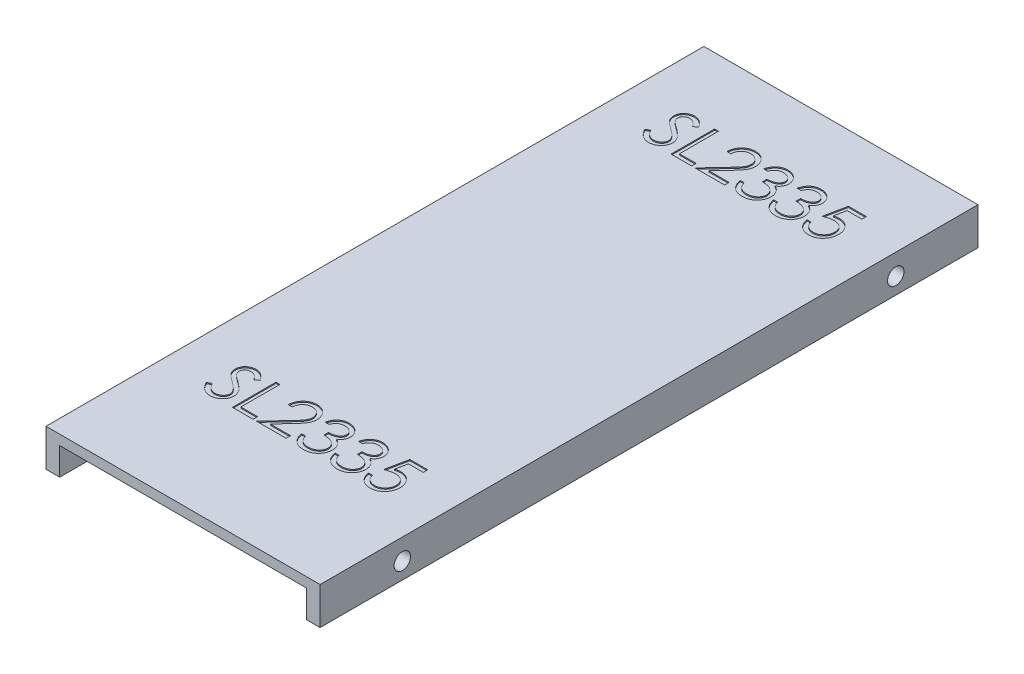
from build123d import *

# Parameters (mm, degrees)
BOSS_EXTRUDE1_DEPTH = 1200
SKETCH2_R           = 15
CUT_EXTRUDE1_DEPTH  = 1200
SKETCH4_R           = 15
CUT_EXTRUDE2_DEPTH  = 1200
CUT_EXTRUDE3_DEPTH  = 2
CUT_EXTRUDE6_DEPTH  = 2


with BuildPart() as part:
    # Sketch1 → Boss-Extrude1 (new body)
    with BuildSketch(Plane.XY):
        Polygon((0, 0), (25, 0), (25, 50), (475, 50), (475, 0), (500, 0), (500, 68), (0, 68), align=None)
    extrude(amount=BOSS_EXTRUDE1_DEPTH)

    # Sketch2 → Cut-Extrude1 (cut)
    with BuildSketch(Plane(origin=(500, 0, 0), x_dir=(0, 0, -1), z_dir=(1, 0, 0))):
        with Locations((-1050, 30)):
            Circle(SKETCH2_R)
    extrude(amount=-CUT_EXTRUDE1_DEPTH, mode=Mode.SUBTRACT)

    # Sketch4 → Cut-Extrude2 (cut)
    with BuildSketch(Plane(origin=(500, 0, 0), x_dir=(0, 0, -1), z_dir=(1, 0, 0))):
        with Locations((-150, 30)):
            Circle(SKETCH4_R)
    extrude(amount=-CUT_EXTRUDE2_DEPTH, mode=Mode.SUBTRACT)

    # Sketch9 → Cut-Extrude3 (cut)
    with BuildSketch(Plane(origin=(0, 68, 0), x_dir=(1, 0, 0), z_dir=(0, 1, 0))):
        with BuildLine():
            Line((77.03525641, -184.687875601), (83.745242388, -180.665064103))
            add(Edge.make_bspline(
                [(83.745242388, -180.665064103), (84.369316697, -181.709738547), (85.56501899, -183.711294468), (87.55963017, -186.415896456), (89.626394406, -188.714645368), (91.780616792, -190.594168432), (94.009148115, -192.073919971), (96.326536477, -193.121720583), (98.724972541, -193.775225739), (100.357235992, -193.854602702), (101.172125401, -193.894230769)],
                knots=[0, 0, 0, 0, 1.272034388, 2.437168799, 3.508375237, 4.49857839, 5.41946034, 6.295179144, 7.148887113, 8, 8, 8, 8], degree=3))
            add(Edge.make_bspline(
                [(101.172125401, -193.894230769), (101.868059559, -193.874848018), (103.247750662, -193.836421667), (105.278894386, -193.467196335), (107.251517402, -192.899956983), (109.124963293, -192.087589429), (110.873381694, -191.104734485), (112.406604963, -189.917597959), (113.732079316, -188.588492937), (114.816321735, -187.105707733), (115.648172536, -185.511015256), (116.287528373, -183.874167788), (116.642336293, -182.169452043), (116.695784095, -181.021679046), (116.72275641, -180.442457933)],
                knots=[0, 0, 0, 0, 1.095163259, 2.171163733, 3.241058638, 4.321873601, 5.38011039, 6.391990106, 7.366004449, 8.327778327, 9.272591725, 10.192022065, 11.087607919, 12, 12, 12, 12], degree=3))
            add(Edge.make_bspline(
                [(116.72275641, -180.442457933), (116.68932115, -179.781585091), (116.621352151, -178.438127176), (116.046870371, -176.456027904), (115.14314638, -174.494499977), (114.309422139, -173.281167704), (113.876577524, -172.651241987)],
                knots=[0, 0, 0, 0, 0.938893495, 1.908633276, 2.914225137, 4, 4, 4, 4], degree=3))
            add(Edge.make_bspline(
                [(113.876577524, -172.651241987), (113.521190381, -172.196608666), (112.775099528, -171.242162877), (111.492455939, -169.82145843), (109.987367275, -168.356005), (108.311340227, -166.789844244), (106.403321962, -165.195817426), (104.323072974, -163.497911837), (102.017481887, -161.760697501), (100.40051116, -160.595641104), (99.566180889, -159.994491186)],
                knots=[0, 0, 0, 0, 0.722233717, 1.516239348, 2.393582979, 3.351407094, 4.387010283, 5.505090956, 6.712668013, 8, 8, 8, 8], degree=3))
            add(Edge.make_bspline(
                [(99.566180889, -159.994491186), (98.731065262, -159.399664288), (97.134387775, -158.262400555), (94.901487783, -156.574564114), (92.904765139, -155.031426358), (91.153094586, -153.61846037), (89.647246586, -152.335474512), (88.375354943, -151.194789107), (87.369819809, -150.16555478), (86.810666462, -149.497867208), (86.559620393, -149.198091947)],
                knots=[0, 0, 0, 0, 1.452282411, 2.77665338, 3.964542531, 5.026858415, 5.96415736, 6.766646006, 7.446254459, 8, 8, 8, 8], degree=3))
            add(Edge.make_bspline(
                [(86.559620393, -149.198091947), (86.20872517, -148.730889861), (85.518642623, -147.812074258), (84.607735, -146.375956948), (83.833507558, -144.905857893), (83.226576097, -143.397826679), (82.715486848, -141.873034542), (82.371726633, -140.311586648), (82.15647531, -138.720489408), (82.134432044, -137.649754662), (82.123397436, -137.113757011)],
                knots=[0, 0, 0, 0, 1.068054152, 2.10047183, 3.106115577, 4.101338837, 5.06977816, 6.043150881, 7.020423561, 8, 8, 8, 8], degree=3))
            add(Edge.make_bspline(
                [(82.123397436, -137.113757011), (82.152997711, -136.273974624), (82.211565577, -134.612359607), (82.706877308, -132.185053274), (83.488673289, -129.867611312), (84.583932353, -127.682976958), (85.995840178, -125.688034177), (87.629739954, -123.859835454), (89.575821874, -122.322940822), (91.711068866, -120.980095926), (94.048240161, -119.929036551), (96.497319578, -119.136171465), (99.062199604, -118.6869258), (100.799449264, -118.622455952), (101.680939503, -118.58974359)],
                knots=[0, 0, 0, 0, 1.005424448, 1.989358655, 2.955360095, 3.929531133, 4.905563448, 5.876582895, 6.856512386, 7.866279853, 8.892233794, 9.918561126, 10.94386622, 12, 12, 12, 12], degree=3))
            add(Edge.make_bspline(
                [(101.680939503, -118.58974359), (102.616296778, -118.622005028), (104.476423862, -118.686162731), (107.212575715, -119.243999602), (109.846934819, -120.167032695), (111.966094575, -121.214525474), (113.62464113, -122.26072008), (114.889487032, -123.213669666), (116.171222076, -124.310748022), (117.480185105, -125.554877353), (118.794196489, -126.957473315), (120.132764067, -128.50893001), (121.49901802, -130.199766188), (122.377945562, -131.40682183), (122.828525641, -132.025615986)],
                knots=[0, 0, 0, 0, 1.286793592, 2.559021753, 3.825965368, 5.121522368, 5.803751409, 6.523245864, 7.299691795, 8.125521123, 9.008227632, 9.944561021, 10.946284179, 12, 12, 12, 12], degree=3))
            Line((122.828525641, -132.025615986), (116.388847155, -136.907051282))
            add(Edge.make_bspline(
                [(116.388847155, -136.907051282), (116.000001901, -136.406111339), (115.251176857, -135.441418131), (114.114311708, -134.090425795), (113.042779872, -132.856337777), (111.987083305, -131.784432195), (111.002977734, -130.816008814), (110.047823383, -129.986885758), (109.135365775, -129.288939219), (107.985178694, -128.544094198), (106.540151868, -127.805759207), (104.72621685, -127.180985472), (102.830599541, -126.805540317), (101.539516827, -126.755899474), (100.885917468, -126.730769231)],
                knots=[0, 0, 0, 0, 1.181633172, 2.275549214, 3.290209073, 4.226197932, 5.078386478, 5.862611352, 6.581680152, 7.217281963, 8.414376989, 9.595101626, 10.782541182, 12, 12, 12, 12], degree=3))
            add(Edge.make_bspline(
                [(100.885917468, -126.730769231), (100.065939192, -126.758248855), (98.484688331, -126.811240721), (96.239731191, -127.38999753), (94.219208247, -128.301264719), (92.483105433, -129.578407972), (91.037641846, -131.091544771), (89.992035906, -132.83277952), (89.362701817, -134.755523293), (89.285905832, -136.096771571), (89.246794872, -136.779847756)],
                knots=[0, 0, 0, 0, 1.14458467, 2.207223713, 3.21896685, 4.227309161, 5.202851033, 6.127160689, 7.046193047, 8, 8, 8, 8], degree=3))
            add(Edge.make_bspline(
                [(89.246794872, -136.779847756), (89.255710422, -137.205104502), (89.273556102, -138.056313371), (89.522448835, -139.313872405), (89.842201474, -140.568254567), (90.348900444, -141.813820285), (91.048427865, -143.07235307), (91.96702739, -144.365524618), (93.123936432, -145.704733011), (94.010147247, -146.575757381), (94.478039864, -147.035632011)],
                knots=[0, 0, 0, 0, 0.858281714, 1.717966888, 2.583508476, 3.4729293, 4.427298488, 5.488583878, 6.674047936, 8, 8, 8, 8], degree=3))
            add(Edge.make_bspline(
                [(94.478039864, -147.035632011), (94.651788845, -147.19068599), (95.064576653, -147.55905875), (95.819227112, -148.162133686), (96.815787001, -148.9060537), (98.028233349, -149.826516056), (99.478921731, -150.894256358), (101.168011665, -152.095622205), (103.076674999, -153.469613865), (104.431082734, -154.430222375), (105.147235577, -154.938151042)],
                knots=[0, 0, 0, 0, 0.420754252, 0.999615792, 1.744751191, 2.668019286, 3.750313428, 4.999500688, 6.413464383, 8, 8, 8, 8], degree=3))
            add(Edge.make_bspline(
                [(105.147235577, -154.938151042), (106.008701825, -155.565017589), (107.676811818, -156.778857775), (110.05029622, -158.602570518), (112.202352225, -160.386189556), (114.140535591, -162.118324574), (115.883994051, -163.785836683), (117.413385216, -165.40878738), (118.744292609, -166.975549474), (120.177107028, -168.984248959), (121.641186149, -171.451248549), (122.898520336, -174.473808601), (123.691325715, -177.508118013), (123.795001155, -179.547530197), (123.846153846, -180.553761018)],
                knots=[0, 0, 0, 0, 1.163667725, 2.253281268, 3.268753668, 4.215851969, 5.092017293, 5.902905408, 6.650798638, 7.335211899, 8.59617414, 9.77448103, 10.901945474, 12, 12, 12, 12], degree=3))
            add(Edge.make_bspline(
                [(123.846153846, -180.553761018), (123.831250892, -181.265377512), (123.80173439, -182.674791389), (123.462442238, -184.744326168), (122.965335546, -186.754347677), (122.216098276, -188.680010405), (121.301626651, -190.556543416), (120.141249244, -192.334722586), (118.79623568, -194.053903411), (117.253327083, -195.668243305), (115.565000369, -197.150201678), (113.78056658, -198.468485751), (111.897105033, -199.567678085), (109.924833208, -200.464634681), (107.863298072, -201.166162668), (105.713192974, -201.674454521), (103.470973702, -201.986414394), (101.946962781, -202.018793984), (101.172125401, -202.03525641)],
                knots=[0, 0, 0, 0, 0.983748083, 1.948392443, 2.894712957, 3.844097841, 4.80183111, 5.778335162, 6.776009319, 7.81870978, 8.863265674, 9.881300176, 10.883814829, 11.87499822, 12.874611388, 13.892143829, 14.928324115, 16, 16, 16, 16], degree=3))
            add(Edge.make_bspline(
                [(101.172125401, -202.03525641), (100.572609587, -202.023663542), (99.381128243, -202.000623805), (97.618788207, -201.796941196), (95.892051095, -201.508762239), (94.222584342, -201.051243152), (92.588878756, -200.49614028), (90.998039688, -199.812645952), (89.449296145, -198.993559419), (87.933968819, -198.057047253), (86.455911645, -196.96716626), (85.028987998, -195.697767323), (83.606379683, -194.283860335), (82.230076231, -192.687049345), (80.872238851, -190.933132108), (79.559639206, -189.005698842), (78.265107395, -186.915248141), (77.452863749, -185.444200661), (77.03525641, -184.687875601)],
                knots=[0, 0, 0, 0, 0.915332311, 1.819136955, 2.706846663, 3.586547465, 4.459518054, 5.340707479, 6.227863349, 7.133153174, 8.059268498, 9.028702269, 10.047606654, 11.120612155, 12.245963614, 13.433783089, 14.680604001, 16, 16, 16, 16], degree=3))
        make_face()
        Polygon((140.128205128, -120.625), (147.251602564, -120.625), (147.251602564, -191.858974359), (177.780448718, -191.858974359), (177.780448718, -200), (140.128205128, -200), align=None)
        with BuildLine():
            Line((194.0625, -145.048076923), (186.939102564, -145.048076923))
            add(Edge.make_bspline(
                [(186.939102564, -145.048076923), (186.98552907, -144.103040718), (187.076709491, -142.247014763), (187.503708194, -139.540919028), (188.114688802, -136.954319129), (188.978548563, -134.50798358), (190.051387363, -132.180282059), (191.337943341, -129.980460274), (192.861803879, -127.916910102), (194.59006374, -126.008761334), (196.467138233, -124.258257496), (198.492469361, -122.746611811), (200.620740515, -121.469407479), (202.845494742, -120.401672173), (205.191832522, -119.600214953), (207.63846162, -119.005545626), (210.196131321, -118.647760643), (211.938753249, -118.609302648), (212.825020032, -118.58974359)],
                knots=[0, 0, 0, 0, 1.10065271, 2.161652631, 3.183658789, 4.190468796, 5.17591951, 6.163126047, 7.15150782, 8.156236427, 9.156009102, 10.134482811, 11.092018607, 12.041330605, 13.001268258, 13.972401359, 14.968799086, 16, 16, 16, 16], degree=3))
            add(Edge.make_bspline(
                [(212.825020032, -118.58974359), (213.695379927, -118.610119298), (215.405606029, -118.650156838), (217.901655285, -118.993987323), (220.277854641, -119.532503419), (222.529559347, -120.288049468), (224.638804025, -121.303696303), (226.621433786, -122.523747626), (228.501052173, -123.934804517), (230.193027444, -125.596096357), (231.746692813, -127.369614719), (233.087047528, -129.263001105), (234.234881771, -131.21855812), (235.191638082, -133.251197692), (235.895946948, -135.380058515), (236.430667023, -137.574146864), (236.732913726, -139.856173828), (236.779301009, -141.400733215), (236.802884615, -142.185997596)],
                knots=[0, 0, 0, 0, 1.111607364, 2.184268762, 3.212621178, 4.221274766, 5.211760367, 6.196651075, 7.1921475, 8.207485113, 9.220403448, 10.201281604, 11.166441695, 12.114753415, 13.065576456, 14.026450734, 14.996634279, 16, 16, 16, 16], degree=3))
            add(Edge.make_bspline(
                [(236.802884615, -142.185997596), (236.764633917, -143.291573627), (236.688803767, -145.483324394), (236.034397654, -148.708316073), (235.023339385, -151.835805809), (233.797040328, -154.352652175), (232.558323883, -156.370520997), (231.465674944, -158.046822147), (230.158201946, -159.834492664), (228.647867752, -161.751537457), (226.957456787, -163.803820488), (225.074802716, -165.992183935), (222.985523664, -168.293385502), (221.519168469, -169.865142329), (220.759339944, -170.67958734)],
                knots=[0, 0, 0, 0, 1.184203166, 2.347625244, 3.513805382, 4.700623107, 5.337941753, 6.051866363, 6.845199593, 7.711357327, 8.668078039, 9.695487809, 10.805859518, 12, 12, 12, 12], degree=3))
            Line((220.759339944, -170.67958734), (200.899689503, -191.858974359))
            Line((200.899689503, -191.858974359), (237.820512821, -191.858974359))
            Line((237.820512821, -191.858974359), (237.820512821, -200))
            Line((237.820512821, -200), (183.886217949, -200))
            Line((183.886217949, -200), (214.669471154, -167.149689503))
            add(Edge.make_bspline(
                [(214.669471154, -167.149689503), (215.418950015, -166.367317194), (216.858545523, -164.864540105), (218.894686104, -162.670547973), (220.723463161, -160.635156603), (222.356714747, -158.762211665), (223.759010315, -157.024317181), (225.003434147, -155.477758724), (226.000510942, -154.054577441), (227.082627952, -152.404924232), (228.13069503, -150.390787754), (229.031314533, -147.929398729), (229.580472703, -145.395584249), (229.646350222, -143.683305909), (229.679487179, -142.822015224)],
                knots=[0, 0, 0, 0, 1.329631726, 2.553950428, 3.673215718, 4.687767853, 5.603093632, 6.413772471, 7.123043292, 7.734684054, 8.834405432, 9.900288307, 10.943827018, 12, 12, 12, 12], degree=3))
            add(Edge.make_bspline(
                [(229.679487179, -142.822015224), (229.665069452, -142.280419225), (229.636654881, -141.213037511), (229.385882098, -139.648085476), (229.006911692, -138.138490591), (228.463867447, -136.679609408), (227.747071735, -135.286109799), (226.87455044, -133.956295515), (225.867847216, -132.670670769), (224.703273787, -131.465229902), (223.423941105, -130.361209706), (222.072428659, -129.383217055), (220.642542366, -128.565901507), (219.140311024, -127.895897196), (217.5699227, -127.370312658), (215.928340087, -127.006127017), (214.220099004, -126.777470685), (213.053660798, -126.746533215), (212.459309896, -126.730769231)],
                knots=[0, 0, 0, 0, 0.991446411, 1.95395049, 2.89581595, 3.838931463, 4.798493298, 5.75982156, 6.748411868, 7.785213223, 8.824556874, 9.840280684, 10.836137867, 11.835679398, 12.848801643, 13.863922112, 14.911575587, 16, 16, 16, 16], degree=3))
            add(Edge.make_bspline(
                [(212.459309896, -126.730769231), (211.83857851, -126.746985141), (210.61956456, -126.778830511), (208.829793635, -127.001594498), (207.122419751, -127.38590195), (205.493148024, -127.911515816), (203.939221703, -128.579593619), (202.468197847, -129.411709972), (201.083378751, -130.404657049), (199.782161168, -131.530433951), (198.583281643, -132.783824193), (197.529932851, -134.181050141), (196.609545387, -135.696600454), (195.806514557, -137.326385797), (195.154376585, -139.085194736), (194.656056924, -140.966783757), (194.261748078, -142.962982943), (194.130019129, -144.341501832), (194.0625, -145.048076923)],
                knots=[0, 0, 0, 0, 1.031018746, 2.02475058, 2.990194455, 3.934040569, 4.864654155, 5.795059489, 6.735614925, 7.690564532, 8.649604399, 9.611025574, 10.590972636, 11.591080095, 12.624614302, 13.701020113, 14.821632451, 16, 16, 16, 16], degree=3))
        make_face()
        with BuildLine():
            Line((255.120192308, -138.942307692), (247.996794872, -138.942307692))
            add(Edge.make_bspline(
                [(247.996794872, -138.942307692), (248.189779325, -138.143285288), (248.567048145, -136.581261842), (249.353939544, -134.349525748), (250.211172653, -132.237617316), (251.240532703, -130.285081359), (252.363320522, -128.452677672), (253.649710814, -126.781967171), (255.040354522, -125.230458847), (256.578527479, -123.853569352), (258.191623913, -122.606752993), (259.902373325, -121.543693657), (261.676356806, -120.629199476), (263.525865357, -119.875812075), (265.456405322, -119.308268949), (267.450523566, -118.896498536), (269.5134458, -118.62909291), (270.913792944, -118.602995247), (271.62484976, -118.58974359)],
                knots=[0, 0, 0, 0, 1.162005537, 2.271625781, 3.343758855, 4.383309926, 5.390229558, 6.379919256, 7.361854164, 8.333198761, 9.295911338, 10.242430842, 11.177959212, 12.116337295, 13.062827104, 14.020064771, 14.994644689, 16, 16, 16, 16], degree=3))
            add(Edge.make_bspline(
                [(271.62484976, -118.58974359), (272.660869089, -118.621022561), (274.710309158, -118.682898219), (277.721185402, -119.247922047), (280.624650764, -120.142027727), (283.388924777, -121.377414039), (285.956557087, -122.901126319), (288.241109894, -124.714612317), (290.211617192, -126.78288219), (291.864757543, -129.067352845), (293.159136986, -131.508826004), (294.113595813, -134.021615282), (294.694658935, -136.599759991), (294.76996442, -138.340505429), (294.807692308, -139.212615184)],
                knots=[0, 0, 0, 0, 1.083050992, 2.142477498, 3.193116406, 4.255571735, 5.30263384, 6.308962982, 7.297363603, 8.282367274, 9.249857812, 10.179914175, 11.08814088, 12, 12, 12, 12], degree=3))
            add(Edge.make_bspline(
                [(294.807692308, -139.212615184), (294.781303725, -140.051876421), (294.729665364, -141.694180424), (294.291204541, -144.091792949), (293.55332858, -146.351522098), (292.53121075, -148.482880596), (291.208107735, -150.472354642), (289.605351931, -152.324420381), (287.711630851, -154.04729236), (286.276554935, -155.034251837), (285.537735377, -155.542367788)],
                knots=[0, 0, 0, 0, 1.024540389, 2.004866551, 2.965041327, 3.920577974, 4.882998113, 5.874504559, 6.905732034, 8, 8, 8, 8], degree=3))
            add(Edge.make_bspline(
                [(285.537735377, -155.542367788), (286.382098382, -155.950087036), (288.055025709, -156.757896789), (290.335368075, -158.342125575), (292.405419892, -160.17129631), (293.559843519, -161.59874576), (294.139873798, -162.315955529)],
                knots=[0, 0, 0, 0, 1.015518401, 2.012035669, 3.001164323, 4, 4, 4, 4], degree=3))
            add(Edge.make_bspline(
                [(294.139873798, -162.315955529), (294.521811384, -162.838872396), (295.279432062, -163.876143004), (296.21459506, -165.543844091), (297.062980331, -167.230029651), (297.724065662, -168.979894752), (298.236008713, -170.773157741), (298.601950873, -172.612897795), (298.829284068, -174.500617232), (298.861840337, -175.777703837), (298.878205128, -176.419646434)],
                knots=[0, 0, 0, 0, 1.025084078, 2.033381695, 3.024893161, 4.013698104, 4.991890475, 5.976764909, 6.982997093, 8, 8, 8, 8], degree=3))
            add(Edge.make_bspline(
                [(298.878205128, -176.419646434), (298.837508125, -177.531116897), (298.75630564, -179.748827224), (298.030498955, -183.025307519), (296.905341532, -186.22810016), (295.307478877, -189.29140455), (293.360126445, -192.157531047), (291.043344271, -194.721940199), (288.38345608, -196.92626569), (285.41697083, -198.767997648), (282.203028809, -200.240243383), (278.765510919, -201.262081819), (275.153947195, -201.927607169), (272.677281697, -201.99897366), (271.41814403, -202.03525641)],
                knots=[0, 0, 0, 0, 0.955779014, 1.907060117, 2.875433937, 3.871313158, 4.872415639, 5.851225146, 6.836215519, 7.83643374, 8.849228613, 9.86973379, 10.916971861, 12, 12, 12, 12], degree=3))
            add(Edge.make_bspline(
                [(271.41814403, -202.03525641), (270.569527756, -202.015566574), (268.899733909, -201.976823542), (266.444925999, -201.71196955), (264.10173746, -201.228235503), (261.867000152, -200.577285542), (259.73872879, -199.75197282), (257.723417834, -198.72420949), (255.808668463, -197.515180782), (254.012549392, -196.110615487), (252.335274732, -194.539413675), (250.821418307, -192.773682556), (249.44574086, -190.84606286), (248.245077447, -188.734164978), (247.164739414, -186.465281465), (246.27617129, -184.010360163), (245.494087858, -181.391347521), (245.130471794, -179.566227342), (244.943910256, -178.629807692)],
                knots=[0, 0, 0, 0, 1.048658725, 2.063410685, 3.046034179, 4.001477787, 4.936774919, 5.862367409, 6.792675028, 7.730719943, 8.675894397, 9.627829632, 10.600096036, 11.597688215, 12.626045268, 13.701542398, 14.82072376, 16, 16, 16, 16], degree=3))
            Line((244.943910256, -178.629807692), (252.067307692, -178.629807692))
            add(Edge.make_bspline(
                [(252.067307692, -178.629807692), (252.252893052, -179.240972815), (252.613872696, -180.429742064), (253.228332669, -182.140620425), (253.928380982, -183.709026275), (254.679371866, -185.146464934), (255.468097338, -186.467092632), (256.350632247, -187.635988591), (257.261611075, -188.70449407), (257.948303553, -189.306487948), (258.284380008, -189.601111779)],
                knots=[0, 0, 0, 0, 1.198163088, 2.33053128, 3.407730985, 4.417276592, 5.372219308, 6.28897303, 7.162600585, 8, 8, 8, 8], degree=3))
            add(Edge.make_bspline(
                [(258.284380008, -189.601111779), (258.728802368, -189.943747208), (259.616275259, -190.627960429), (261.062447643, -191.501122362), (262.583383452, -192.257702758), (264.212037671, -192.835636571), (265.913265501, -193.324987093), (267.714564677, -193.645220295), (269.600043351, -193.86493418), (270.88745513, -193.884322805), (271.545347556, -193.894230769)],
                knots=[0, 0, 0, 0, 0.946170439, 1.889420265, 2.845303464, 3.807233317, 4.801018734, 5.828864929, 6.890507805, 8, 8, 8, 8], degree=3))
            add(Edge.make_bspline(
                [(271.545347556, -193.894230769), (272.288150205, -193.880262918), (273.740636662, -193.852949991), (275.860059365, -193.601768782), (277.876353265, -193.235954049), (279.767132117, -192.670963188), (281.557163266, -191.97289745), (283.221354249, -191.096406827), (284.781551657, -190.068053318), (286.217772102, -188.899218827), (287.509214861, -187.619659921), (288.646307394, -186.281327773), (289.612973824, -184.889865211), (290.392744258, -183.437572111), (291.008479952, -181.930462456), (291.427652536, -180.364306862), (291.71910654, -178.751922432), (291.742842209, -177.655890458), (291.754807692, -177.103365385)],
                knots=[0, 0, 0, 0, 1.217147791, 2.380027433, 3.494444702, 4.572153297, 5.609568379, 6.639424714, 7.649109417, 8.668170816, 9.669597737, 10.625200337, 11.543417969, 12.441394052, 13.322311151, 14.205496177, 15.095365482, 16, 16, 16, 16], degree=3))
            add(Edge.make_bspline(
                [(291.754807692, -177.103365385), (291.72010264, -176.363786807), (291.650865222, -174.888309691), (291.122259939, -172.717571846), (290.252789268, -170.626076599), (289.035573387, -168.649507789), (287.553852398, -166.817625736), (285.822005403, -165.183147473), (283.825650938, -163.834450765), (281.988236051, -162.902618736), (280.360704823, -162.266777924), (278.96789164, -161.843256408), (277.4085901, -161.484625289), (275.70165683, -161.150971988), (273.834230315, -160.867005699), (271.808343596, -160.630200235), (269.623586145, -160.440719842), (268.111125777, -160.356103932), (267.331730769, -160.3125)],
                knots=[0, 0, 0, 0, 1.07054697, 2.135767047, 3.216561865, 4.33974944, 5.486079747, 6.621378074, 7.775625952, 8.963672916, 9.598146892, 10.304877434, 11.070270905, 11.915000392, 12.823868403, 13.805723172, 14.86925407, 16, 16, 16, 16], degree=3))
            Line((267.331730769, -160.3125), (267.331730769, -152.171474359))
            add(Edge.make_bspline(
                [(267.331730769, -152.171474359), (268.313739349, -152.15481006), (270.237252923, -152.122168793), (273.046998763, -151.727379986), (275.733804234, -151.181265742), (278.238124991, -150.344762275), (280.520694025, -149.373205542), (282.500977858, -148.242628648), (284.151232805, -146.985901299), (285.463439248, -145.583626051), (286.450619969, -144.07969551), (287.172406268, -142.512228452), (287.59877081, -140.867486356), (287.65568647, -139.745017994), (287.684294872, -139.180814303)],
                knots=[0, 0, 0, 0, 1.321986639, 2.589447074, 3.816329219, 5.01088745, 6.139805852, 7.153945165, 8.075214402, 8.924034688, 9.728124013, 10.488707548, 11.240355623, 12, 12, 12, 12], degree=3))
            add(Edge.make_bspline(
                [(287.684294872, -139.180814303), (287.674896623, -138.766301154), (287.656199253, -137.941646904), (287.420403846, -136.736846239), (287.066072917, -135.568878358), (286.578943342, -134.442710161), (285.926929907, -133.366152164), (285.146651284, -132.33002609), (284.217553295, -131.34024753), (283.152897622, -130.417675997), (282.009629902, -129.538445083), (280.756643932, -128.792010816), (279.431719274, -128.153721015), (278.033389066, -127.627362664), (276.557115432, -127.231410949), (275.00983457, -126.947115974), (273.388596034, -126.769369162), (272.282522826, -126.743778301), (271.720252404, -126.730769231)],
                knots=[0, 0, 0, 0, 0.884392785, 1.759457502, 2.611959086, 3.489218968, 4.37281399, 5.2945488, 6.255912374, 7.266815255, 8.301784654, 9.332968512, 10.37626691, 11.440494194, 12.520033166, 13.637162961, 14.798855837, 16, 16, 16, 16], degree=3))
            add(Edge.make_bspline(
                [(271.720252404, -126.730769231), (270.816473504, -126.762323333), (269.051183111, -126.823955835), (266.506309103, -127.363774175), (264.140495636, -128.225062855), (262.33213659, -129.253150974), (260.996763926, -130.268026884), (260.042519077, -131.154359575), (259.105428931, -132.139353969), (258.247143045, -133.283677837), (257.379143931, -134.5098354), (256.588919053, -135.880158178), (255.821029604, -137.358900692), (255.358328925, -138.404283832), (255.120192308, -138.942307692)],
                knots=[0, 0, 0, 0, 1.472543308, 2.876219568, 4.221790263, 5.565193594, 6.249813518, 6.953379497, 7.687249741, 8.463570142, 9.283606569, 10.136032583, 11.040678096, 12, 12, 12, 12], degree=3))
        make_face()
        with BuildLine():
            Line((316.177884615, -138.942307692), (309.054487179, -138.942307692))
            add(Edge.make_bspline(
                [(309.054487179, -138.942307692), (309.247471632, -138.143285288), (309.624740453, -136.581261842), (310.411631851, -134.349525748), (311.26886496, -132.237617316), (312.29822501, -130.285081359), (313.421012829, -128.452677672), (314.707403121, -126.781967171), (316.098046829, -125.230458847), (317.636219787, -123.853569352), (319.24931622, -122.606752993), (320.960065633, -121.543693657), (322.734049114, -120.629199476), (324.583557665, -119.875812075), (326.51409763, -119.308268949), (328.508215873, -118.896498536), (330.571138108, -118.62909291), (331.971485252, -118.602995247), (332.682542067, -118.58974359)],
                knots=[0, 0, 0, 0, 1.162005537, 2.271625781, 3.343758855, 4.383309926, 5.390229558, 6.379919256, 7.361854164, 8.333198761, 9.295911338, 10.242430842, 11.177959212, 12.116337295, 13.062827104, 14.020064771, 14.994644689, 16, 16, 16, 16], degree=3))
            add(Edge.make_bspline(
                [(332.682542067, -118.58974359), (333.718561397, -118.621022561), (335.768001466, -118.682898219), (338.778877709, -119.247922047), (341.682343071, -120.142027727), (344.446617084, -121.377414039), (347.014249395, -122.901126319), (349.298802201, -124.714612317), (351.2693095, -126.78288219), (352.922449851, -129.067352845), (354.216829293, -131.508826004), (355.171288121, -134.021615282), (355.752351243, -136.599759991), (355.827656728, -138.340505429), (355.865384615, -139.212615184)],
                knots=[0, 0, 0, 0, 1.083050992, 2.142477498, 3.193116406, 4.255571735, 5.30263384, 6.308962982, 7.297363603, 8.282367274, 9.249857812, 10.179914175, 11.08814088, 12, 12, 12, 12], degree=3))
            add(Edge.make_bspline(
                [(355.865384615, -139.212615184), (355.838996033, -140.051876421), (355.787357671, -141.694180424), (355.348896849, -144.091792949), (354.611020887, -146.351522098), (353.588903057, -148.482880596), (352.265800043, -150.472354642), (350.663044238, -152.324420381), (348.769323159, -154.04729236), (347.334247243, -155.034251837), (346.595427684, -155.542367788)],
                knots=[0, 0, 0, 0, 1.024540389, 2.004866551, 2.965041327, 3.920577974, 4.882998113, 5.874504559, 6.905732034, 8, 8, 8, 8], degree=3))
            add(Edge.make_bspline(
                [(346.595427684, -155.542367788), (347.43979069, -155.950087036), (349.112718017, -156.757896789), (351.393060383, -158.342125575), (353.463112199, -160.17129631), (354.617535827, -161.59874576), (355.197566106, -162.315955529)],
                knots=[0, 0, 0, 0, 1.015518401, 2.012035669, 3.001164323, 4, 4, 4, 4], degree=3))
            add(Edge.make_bspline(
                [(355.197566106, -162.315955529), (355.579503691, -162.838872396), (356.33712437, -163.876143004), (357.272287367, -165.543844091), (358.120672638, -167.230029651), (358.781757969, -168.979894752), (359.293701021, -170.773157741), (359.659643181, -172.612897795), (359.886976376, -174.500617232), (359.919532645, -175.777703837), (359.935897436, -176.419646434)],
                knots=[0, 0, 0, 0, 1.025084078, 2.033381695, 3.024893161, 4.013698104, 4.991890475, 5.976764909, 6.982997093, 8, 8, 8, 8], degree=3))
            add(Edge.make_bspline(
                [(359.935897436, -176.419646434), (359.895200433, -177.531116897), (359.813997948, -179.748827224), (359.088191262, -183.025307519), (357.96303384, -186.22810016), (356.365171185, -189.29140455), (354.417818752, -192.157531047), (352.101036579, -194.721940199), (349.441148388, -196.92626569), (346.474663137, -198.767997648), (343.260721116, -200.240243383), (339.823203227, -201.262081819), (336.211639503, -201.927607169), (333.734974005, -201.99897366), (332.475836338, -202.03525641)],
                knots=[0, 0, 0, 0, 0.955779014, 1.907060117, 2.875433937, 3.871313158, 4.872415639, 5.851225146, 6.836215519, 7.83643374, 8.849228613, 9.86973379, 10.916971861, 12, 12, 12, 12], degree=3))
            add(Edge.make_bspline(
                [(332.475836338, -202.03525641), (331.627220064, -202.015566574), (329.957426217, -201.976823542), (327.502618307, -201.71196955), (325.159429768, -201.228235503), (322.924692459, -200.577285542), (320.796421098, -199.75197282), (318.781110141, -198.72420949), (316.866360771, -197.515180782), (315.0702417, -196.110615487), (313.392967039, -194.539413675), (311.879110615, -192.773682556), (310.503433168, -190.84606286), (309.302769754, -188.734164978), (308.222431722, -186.465281465), (307.333863598, -184.010360163), (306.551780166, -181.391347521), (306.188164102, -179.566227342), (306.001602564, -178.629807692)],
                knots=[0, 0, 0, 0, 1.048658725, 2.063410685, 3.046034179, 4.001477787, 4.936774919, 5.862367409, 6.792675028, 7.730719943, 8.675894397, 9.627829632, 10.600096036, 11.597688215, 12.626045268, 13.701542398, 14.82072376, 16, 16, 16, 16], degree=3))
            Line((306.001602564, -178.629807692), (313.125, -178.629807692))
            add(Edge.make_bspline(
                [(313.125, -178.629807692), (313.310585359, -179.240972815), (313.671565004, -180.429742064), (314.286024977, -182.140620425), (314.98607329, -183.709026275), (315.737064173, -185.146464934), (316.525789646, -186.467092632), (317.408324555, -187.635988591), (318.319303382, -188.70449407), (319.00599586, -189.306487948), (319.342072316, -189.601111779)],
                knots=[0, 0, 0, 0, 1.198163088, 2.33053128, 3.407730985, 4.417276592, 5.372219308, 6.28897303, 7.162600585, 8, 8, 8, 8], degree=3))
            add(Edge.make_bspline(
                [(319.342072316, -189.601111779), (319.786494676, -189.943747208), (320.673967567, -190.627960429), (322.12013995, -191.501122362), (323.64107576, -192.257702758), (325.269729979, -192.835636571), (326.970957809, -193.324987093), (328.772256984, -193.645220295), (330.657735658, -193.86493418), (331.945147437, -193.884322805), (332.603039864, -193.894230769)],
                knots=[0, 0, 0, 0, 0.946170439, 1.889420265, 2.845303464, 3.807233317, 4.801018734, 5.828864929, 6.890507805, 8, 8, 8, 8], degree=3))
            add(Edge.make_bspline(
                [(332.603039864, -193.894230769), (333.345842513, -193.880262918), (334.79832897, -193.852949991), (336.917751673, -193.601768782), (338.934045573, -193.235954049), (340.824824425, -192.670963188), (342.614855574, -191.97289745), (344.279046556, -191.096406827), (345.839243965, -190.068053318), (347.275464409, -188.899218827), (348.566907169, -187.619659921), (349.703999701, -186.281327773), (350.670666131, -184.889865211), (351.450436565, -183.437572111), (352.06617226, -181.930462456), (352.485344844, -180.364306862), (352.776798848, -178.751922432), (352.800534517, -177.655890458), (352.8125, -177.103365385)],
                knots=[0, 0, 0, 0, 1.217147791, 2.380027433, 3.494444702, 4.572153297, 5.609568379, 6.639424714, 7.649109417, 8.668170816, 9.669597737, 10.625200337, 11.543417969, 12.441394052, 13.322311151, 14.205496177, 15.095365482, 16, 16, 16, 16], degree=3))
            add(Edge.make_bspline(
                [(352.8125, -177.103365385), (352.777794948, -176.363786807), (352.70855753, -174.888309691), (352.179952246, -172.717571846), (351.310481576, -170.626076599), (350.093265694, -168.649507789), (348.611544706, -166.817625736), (346.879697711, -165.183147473), (344.883343246, -163.834450765), (343.045928359, -162.902618736), (341.418397131, -162.266777924), (340.025583948, -161.843256408), (338.466282407, -161.484625289), (336.759349138, -161.150971988), (334.891922622, -160.867005699), (332.866035904, -160.630200235), (330.681278453, -160.440719842), (329.168818085, -160.356103932), (328.389423077, -160.3125)],
                knots=[0, 0, 0, 0, 1.07054697, 2.135767047, 3.216561865, 4.33974944, 5.486079747, 6.621378074, 7.775625952, 8.963672916, 9.598146892, 10.304877434, 11.070270905, 11.915000392, 12.823868403, 13.805723172, 14.86925407, 16, 16, 16, 16], degree=3))
            Line((328.389423077, -160.3125), (328.389423077, -152.171474359))
            add(Edge.make_bspline(
                [(328.389423077, -152.171474359), (329.371431657, -152.15481006), (331.29494523, -152.122168793), (334.10469107, -151.727379986), (336.791496542, -151.181265742), (339.295817298, -150.344762275), (341.578386333, -149.373205542), (343.558670166, -148.242628648), (345.208925113, -146.985901299), (346.521131556, -145.583626051), (347.508312277, -144.07969551), (348.230098576, -142.512228452), (348.656463117, -140.867486356), (348.713378778, -139.745017994), (348.741987179, -139.180814303)],
                knots=[0, 0, 0, 0, 1.321986639, 2.589447074, 3.816329219, 5.01088745, 6.139805852, 7.153945165, 8.075214402, 8.924034688, 9.728124013, 10.488707548, 11.240355623, 12, 12, 12, 12], degree=3))
            add(Edge.make_bspline(
                [(348.741987179, -139.180814303), (348.732588931, -138.766301154), (348.713891561, -137.941646904), (348.478096154, -136.736846239), (348.123765225, -135.568878358), (347.636635649, -134.442710161), (346.984622214, -133.366152164), (346.204343591, -132.33002609), (345.275245603, -131.34024753), (344.21058993, -130.417675997), (343.06732221, -129.538445083), (341.81433624, -128.792010816), (340.489411581, -128.153721015), (339.091081373, -127.627362664), (337.614807739, -127.231410949), (336.067526878, -126.947115974), (334.446288341, -126.769369162), (333.340215133, -126.743778301), (332.777944712, -126.730769231)],
                knots=[0, 0, 0, 0, 0.884392785, 1.759457502, 2.611959086, 3.489218968, 4.37281399, 5.2945488, 6.255912374, 7.266815255, 8.301784654, 9.332968512, 10.37626691, 11.440494194, 12.520033166, 13.637162961, 14.798855837, 16, 16, 16, 16], degree=3))
            add(Edge.make_bspline(
                [(332.777944712, -126.730769231), (331.874165812, -126.762323333), (330.108875419, -126.823955835), (327.564001411, -127.363774175), (325.198187943, -128.225062855), (323.389828897, -129.253150974), (322.054456233, -130.268026884), (321.100211385, -131.154359575), (320.163121238, -132.139353969), (319.304835353, -133.283677837), (318.436836239, -134.5098354), (317.646611361, -135.880158178), (316.878721912, -137.358900692), (316.416021233, -138.404283832), (316.177884615, -138.942307692)],
                knots=[0, 0, 0, 0, 1.472543308, 2.876219568, 4.221790263, 5.565193594, 6.249813518, 6.953379497, 7.687249741, 8.463570142, 9.283606569, 10.136032583, 11.040678096, 12, 12, 12, 12], degree=3))
        make_face()
        with BuildLine():
            Line((416.923076923, -120.625), (416.923076923, -128.766025641))
            Line((416.923076923, -128.766025641), (389.940029046, -128.766025641))
            Line((389.940029046, -128.766025641), (385.646910056, -149.643304287))
            add(Edge.make_bspline(
                [(385.646910056, -149.643304287), (386.48728435, -149.411296337), (388.11537663, -148.961817628), (390.518394906, -148.462758192), (392.799682377, -148.161916871), (394.280034528, -148.120838936), (394.996369191, -148.100961538)],
                knots=[0, 0, 0, 0, 1.100273476, 2.13160584, 3.095893838, 4, 4, 4, 4], degree=3))
            add(Edge.make_bspline(
                [(394.996369191, -148.100961538), (395.882732573, -148.120146152), (397.625544441, -148.157867894), (400.175499132, -148.520086623), (402.609655818, -149.090223972), (404.922923856, -149.886707233), (407.119582772, -150.905195825), (409.179422112, -152.17746233), (411.133360496, -153.663664661), (412.946344323, -155.372381897), (414.591092027, -157.252925705), (416.037213578, -159.274898852), (417.265543751, -161.41865119), (418.253439442, -163.704664995), (419.042298451, -166.107667224), (419.56735262, -168.652941864), (419.916981555, -171.316497443), (419.956042817, -173.137690372), (419.975961538, -174.06638121)],
                knots=[0, 0, 0, 0, 1.052922333, 2.070308379, 3.05430497, 4.020497103, 4.973039431, 5.925935799, 6.892292201, 7.88610001, 8.88166317, 9.857072816, 10.836096531, 11.812156883, 12.81219415, 13.836441305, 14.89672472, 16, 16, 16, 16], degree=3))
            add(Edge.make_bspline(
                [(419.975961538, -174.06638121), (419.960878581, -174.713224421), (419.9309165, -175.998169318), (419.77854853, -177.906439584), (419.48518497, -179.774310977), (419.091309798, -181.602031292), (418.580079962, -183.386140268), (417.961203204, -185.131744562), (417.203829009, -186.827979394), (416.373081748, -188.490894602), (415.43767055, -190.082896462), (414.399479401, -191.571721692), (413.302619154, -192.979704504), (412.122394877, -194.291744521), (410.847836595, -195.499220105), (409.494380203, -196.609297204), (408.072825682, -197.640748802), (406.561180008, -198.551706085), (404.99312727, -199.389973126), (403.34602306, -200.077667634), (401.657360746, -200.692495681), (399.902835888, -201.182568897), (398.086422638, -201.566575044), (396.205126837, -201.827392236), (394.268815213, -202.017357872), (392.956292606, -202.029249538), (392.293294271, -202.03525641)],
                knots=[0, 0, 0, 0, 1.056347294, 2.098418968, 3.122841568, 4.141288669, 5.149314143, 6.15115421, 7.162517403, 8.180376062, 9.185164535, 10.17417709, 11.141909838, 12.097768115, 13.052685741, 14.0056014, 14.954263652, 15.917497458, 16.885230207, 17.854509472, 18.828990115, 19.81800267, 20.826176721, 21.857883937, 22.917946725, 24, 24, 24, 24], degree=3))
            add(Edge.make_bspline(
                [(392.293294271, -202.03525641), (391.502397673, -202.019589192), (389.946402048, -201.98876579), (387.666739188, -201.666310857), (385.473390094, -201.204486324), (383.384011014, -200.50969949), (381.379876998, -199.639130485), (379.487968934, -198.538853025), (377.659945084, -197.292005493), (375.970118537, -195.820611774), (374.401756678, -194.212345414), (372.997805494, -192.467056052), (371.747454736, -190.613549062), (370.67072726, -188.642823067), (369.752289991, -186.560056384), (369.030771506, -184.357445471), (368.4484231, -182.046498953), (368.202056243, -180.455517556), (368.076923077, -179.647435897)],
                knots=[0, 0, 0, 0, 1.0467383, 2.05933395, 3.04377827, 4.011590433, 4.970194871, 5.932262533, 6.905835911, 7.896367577, 8.894135286, 9.877477877, 10.858688626, 11.851381753, 12.8477658, 13.868841284, 14.917554742, 16, 16, 16, 16], degree=3))
            Line((368.076923077, -179.647435897), (375.200320513, -179.647435897))
            add(Edge.make_bspline(
                [(375.200320513, -179.647435897), (375.375593154, -180.404366158), (375.712476901, -181.859228149), (376.451928704, -183.903278212), (377.356029808, -185.724803463), (378.43109271, -187.347899369), (379.713566615, -188.763246272), (381.177001879, -190.024561783), (382.817744887, -191.162462038), (384.640948485, -192.110942651), (386.564387963, -192.919859023), (388.577501475, -193.458513533), (390.625475047, -193.837265925), (392.010645228, -193.875179071), (392.706705729, -193.894230769)],
                knots=[0, 0, 0, 0, 1.136247022, 2.183929868, 3.172523383, 4.106158343, 5.02341133, 5.958108904, 6.928429099, 7.938127109, 8.96079061, 9.975095812, 10.982467395, 12, 12, 12, 12], degree=3))
            add(Edge.make_bspline(
                [(392.706705729, -193.894230769), (393.386120451, -193.875616699), (394.723893597, -193.838965442), (396.692651831, -193.556866418), (398.593408085, -193.122400069), (400.407407069, -192.472208714), (402.166391984, -191.681980279), (403.825868564, -190.667906238), (405.433844527, -189.500866534), (406.940339698, -188.163814388), (408.320091494, -186.690394528), (409.539203527, -185.114746499), (410.554679956, -183.4338823), (411.41043564, -181.67690187), (412.060251524, -179.824548876), (412.523823776, -177.885504368), (412.796036003, -175.854978924), (412.833482406, -174.47001422), (412.852564103, -173.764272837)],
                knots=[0, 0, 0, 0, 1.027316725, 2.022795036, 3.002884548, 3.971462791, 4.93288096, 5.914575861, 6.907176829, 7.935150275, 8.956128384, 9.956726525, 10.942570165, 11.921478529, 12.907843606, 13.90538589, 14.932640048, 16, 16, 16, 16], degree=3))
            add(Edge.make_bspline(
                [(412.852564103, -173.764272837), (412.837630729, -173.127554898), (412.808400775, -171.881270128), (412.569582484, -170.057930982), (412.154179719, -168.332703059), (411.577602441, -166.697255252), (410.845549319, -165.150045042), (409.950963308, -163.689475641), (408.87705589, -162.334797638), (407.650329131, -161.085377225), (406.306441417, -159.932288099), (404.822270826, -158.949306138), (403.228876057, -158.122356577), (401.545454784, -157.408707329), (399.731965119, -156.89615471), (397.824320064, -156.511347308), (395.801919723, -156.288748905), (394.419191617, -156.257863222), (393.708433494, -156.241987179)],
                knots=[0, 0, 0, 0, 1.045622112, 2.046656509, 3.013763289, 3.955457236, 4.890082067, 5.820317437, 6.762574623, 7.722996705, 8.69280354, 9.665887285, 10.63943826, 11.638615906, 12.663482002, 13.728887084, 14.832589034, 16, 16, 16, 16], degree=3))
            add(Edge.make_bspline(
                [(393.708433494, -156.241987179), (393.093188144, -156.255154158), (391.822862586, -156.282340627), (389.874255622, -156.482512965), (387.826568333, -156.805439821), (385.687650309, -157.249627933), (383.451078072, -157.830904139), (381.121571484, -158.527465135), (378.694232581, -159.360267606), (377.058705617, -159.989194596), (376.217948718, -160.3125)],
                knots=[0, 0, 0, 0, 0.817624296, 1.688186739, 2.600797293, 3.572016777, 4.590301741, 5.671205678, 6.80286297, 8, 8, 8, 8], degree=3))
            Line((376.217948718, -160.3125), (384.358974359, -120.625))
            Line((384.358974359, -120.625), (416.923076923, -120.625))
        make_face()
    extrude(amount=-CUT_EXTRUDE3_DEPTH, mode=Mode.SUBTRACT)

    # Sketch11 → Cut-Extrude6 (cut)
    with BuildSketch(Plane(origin=(0, 68, 0), x_dir=(1, 0, 0), z_dir=(0, 1, 0))):
        with BuildLine():
            Line((77.03525641, -984.687875601), (83.745242388, -980.665064103))
            add(Edge.make_bspline(
                [(83.745242388, -980.665064103), (84.369316697, -981.709738547), (85.56501899, -983.711294468), (87.55963017, -986.415896456), (89.626394406, -988.714645368), (91.780616792, -990.594168432), (94.009148115, -992.073919971), (96.326536477, -993.121720583), (98.724972541, -993.775225739), (100.357235992, -993.854602702), (101.172125401, -993.894230769)],
                knots=[0, 0, 0, 0, 1.272034388, 2.437168799, 3.508375237, 4.49857839, 5.41946034, 6.295179144, 7.148887113, 8, 8, 8, 8], degree=3))
            add(Edge.make_bspline(
                [(101.172125401, -993.894230769), (101.868059559, -993.874848018), (103.247750662, -993.836421667), (105.278894386, -993.467196335), (107.251517402, -992.899956983), (109.124963293, -992.087589429), (110.873381694, -991.104734485), (112.406604963, -989.917597959), (113.732079316, -988.588492937), (114.816321735, -987.105707733), (115.648172536, -985.511015256), (116.287528373, -983.874167788), (116.642336293, -982.169452043), (116.695784095, -981.021679046), (116.72275641, -980.442457933)],
                knots=[0, 0, 0, 0, 1.095163259, 2.171163733, 3.241058638, 4.321873601, 5.38011039, 6.391990106, 7.366004449, 8.327778327, 9.272591725, 10.192022065, 11.087607919, 12, 12, 12, 12], degree=3))
            add(Edge.make_bspline(
                [(116.72275641, -980.442457933), (116.68932115, -979.781585091), (116.621352151, -978.438127176), (116.046870371, -976.456027904), (115.14314638, -974.494499977), (114.309422139, -973.281167704), (113.876577524, -972.651241987)],
                knots=[0, 0, 0, 0, 0.938893495, 1.908633276, 2.914225137, 4, 4, 4, 4], degree=3))
            add(Edge.make_bspline(
                [(113.876577524, -972.651241987), (113.521190381, -972.196608666), (112.775099528, -971.242162877), (111.492455939, -969.82145843), (109.987367275, -968.356005), (108.311340227, -966.789844244), (106.403321962, -965.195817426), (104.323072974, -963.497911837), (102.017481887, -961.760697501), (100.40051116, -960.595641104), (99.566180889, -959.994491186)],
                knots=[0, 0, 0, 0, 0.722233717, 1.516239348, 2.393582979, 3.351407094, 4.387010283, 5.505090956, 6.712668013, 8, 8, 8, 8], degree=3))
            add(Edge.make_bspline(
                [(99.566180889, -959.994491186), (98.731065262, -959.399664288), (97.134387775, -958.262400555), (94.901487783, -956.574564114), (92.904765139, -955.031426358), (91.153094586, -953.61846037), (89.647246586, -952.335474512), (88.375354943, -951.194789107), (87.369819809, -950.16555478), (86.810666462, -949.497867208), (86.559620393, -949.198091947)],
                knots=[0, 0, 0, 0, 1.452282411, 2.77665338, 3.964542531, 5.026858415, 5.96415736, 6.766646006, 7.446254459, 8, 8, 8, 8], degree=3))
            add(Edge.make_bspline(
                [(86.559620393, -949.198091947), (86.20872517, -948.730889861), (85.518642623, -947.812074258), (84.607735, -946.375956948), (83.833507558, -944.905857893), (83.226576097, -943.397826679), (82.715486848, -941.873034542), (82.371726633, -940.311586648), (82.15647531, -938.720489408), (82.134432044, -937.649754662), (82.123397436, -937.113757011)],
                knots=[0, 0, 0, 0, 1.068054152, 2.10047183, 3.106115577, 4.101338837, 5.06977816, 6.043150881, 7.020423561, 8, 8, 8, 8], degree=3))
            add(Edge.make_bspline(
                [(82.123397436, -937.113757011), (82.152997711, -936.273974624), (82.211565577, -934.612359607), (82.706877308, -932.185053274), (83.488673289, -929.867611312), (84.583932353, -927.682976958), (85.995840178, -925.688034177), (87.629739954, -923.859835454), (89.575821874, -922.322940822), (91.711068866, -920.980095926), (94.048240161, -919.929036551), (96.497319578, -919.136171465), (99.062199604, -918.6869258), (100.799449264, -918.622455952), (101.680939503, -918.58974359)],
                knots=[0, 0, 0, 0, 1.005424448, 1.989358655, 2.955360095, 3.929531133, 4.905563448, 5.876582895, 6.856512386, 7.866279853, 8.892233794, 9.918561126, 10.94386622, 12, 12, 12, 12], degree=3))
            add(Edge.make_bspline(
                [(101.680939503, -918.58974359), (102.616296778, -918.622005028), (104.476423862, -918.686162731), (107.212575715, -919.243999602), (109.846934819, -920.167032695), (111.966094575, -921.214525474), (113.62464113, -922.26072008), (114.889487032, -923.213669666), (116.171222076, -924.310748022), (117.480185105, -925.554877353), (118.794196489, -926.957473315), (120.132764067, -928.50893001), (121.49901802, -930.199766188), (122.377945562, -931.40682183), (122.828525641, -932.025615986)],
                knots=[0, 0, 0, 0, 1.286793592, 2.559021753, 3.825965368, 5.121522368, 5.803751409, 6.523245864, 7.299691795, 8.125521123, 9.008227632, 9.944561021, 10.946284179, 12, 12, 12, 12], degree=3))
            Line((122.828525641, -932.025615986), (116.388847155, -936.907051282))
            add(Edge.make_bspline(
                [(116.388847155, -936.907051282), (116.000001901, -936.406111339), (115.251176857, -935.441418131), (114.114311708, -934.090425795), (113.042779872, -932.856337777), (111.987083305, -931.784432195), (111.002977734, -930.816008814), (110.047823383, -929.986885758), (109.135365775, -929.288939219), (107.985178694, -928.544094198), (106.540151868, -927.805759207), (104.72621685, -927.180985472), (102.830599541, -926.805540317), (101.539516827, -926.755899474), (100.885917468, -926.730769231)],
                knots=[0, 0, 0, 0, 1.181633172, 2.275549214, 3.290209073, 4.226197932, 5.078386478, 5.862611352, 6.581680152, 7.217281963, 8.414376989, 9.595101626, 10.782541182, 12, 12, 12, 12], degree=3))
            add(Edge.make_bspline(
                [(100.885917468, -926.730769231), (100.065939192, -926.758248855), (98.484688331, -926.811240721), (96.239731191, -927.38999753), (94.219208247, -928.301264719), (92.483105433, -929.578407972), (91.037641846, -931.091544771), (89.992035906, -932.83277952), (89.362701817, -934.755523293), (89.285905832, -936.096771571), (89.246794872, -936.779847756)],
                knots=[0, 0, 0, 0, 1.14458467, 2.207223713, 3.21896685, 4.227309161, 5.202851033, 6.127160689, 7.046193047, 8, 8, 8, 8], degree=3))
            add(Edge.make_bspline(
                [(89.246794872, -936.779847756), (89.255710422, -937.205104502), (89.273556102, -938.056313371), (89.522448835, -939.313872405), (89.842201474, -940.568254567), (90.348900444, -941.813820285), (91.048427865, -943.07235307), (91.96702739, -944.365524618), (93.123936432, -945.704733011), (94.010147247, -946.575757381), (94.478039864, -947.035632011)],
                knots=[0, 0, 0, 0, 0.858281714, 1.717966888, 2.583508476, 3.4729293, 4.427298488, 5.488583878, 6.674047936, 8, 8, 8, 8], degree=3))
            add(Edge.make_bspline(
                [(94.478039864, -947.035632011), (94.651788845, -947.19068599), (95.064576653, -947.55905875), (95.819227112, -948.162133686), (96.815787001, -948.9060537), (98.028233349, -949.826516056), (99.478921731, -950.894256358), (101.168011665, -952.095622205), (103.076674999, -953.469613865), (104.431082734, -954.430222375), (105.147235577, -954.938151042)],
                knots=[0, 0, 0, 0, 0.420754252, 0.999615792, 1.744751191, 2.668019286, 3.750313428, 4.999500688, 6.413464383, 8, 8, 8, 8], degree=3))
            add(Edge.make_bspline(
                [(105.147235577, -954.938151042), (106.008701825, -955.565017589), (107.676811818, -956.778857775), (110.05029622, -958.602570518), (112.202352225, -960.386189556), (114.140535591, -962.118324574), (115.883994051, -963.785836683), (117.413385216, -965.40878738), (118.744292609, -966.975549474), (120.177107028, -968.984248959), (121.641186149, -971.451248549), (122.898520336, -974.473808601), (123.691325715, -977.508118013), (123.795001155, -979.547530197), (123.846153846, -980.553761018)],
                knots=[0, 0, 0, 0, 1.163667725, 2.253281268, 3.268753668, 4.215851969, 5.092017293, 5.902905408, 6.650798638, 7.335211899, 8.59617414, 9.77448103, 10.901945474, 12, 12, 12, 12], degree=3))
            add(Edge.make_bspline(
                [(123.846153846, -980.553761018), (123.831250892, -981.265377512), (123.80173439, -982.674791389), (123.462442238, -984.744326168), (122.965335546, -986.754347677), (122.216098276, -988.680010405), (121.301626651, -990.556543416), (120.141249244, -992.334722586), (118.79623568, -994.053903411), (117.253327083, -995.668243305), (115.565000369, -997.150201678), (113.78056658, -998.468485751), (111.897105033, -999.567678085), (109.924833208, -1000.464634681), (107.863298072, -1001.166162668), (105.713192974, -1001.674454521), (103.470973702, -1001.986414394), (101.946962781, -1002.018793984), (101.172125401, -1002.03525641)],
                knots=[0, 0, 0, 0, 0.983748083, 1.948392443, 2.894712957, 3.844097841, 4.80183111, 5.778335162, 6.776009319, 7.81870978, 8.863265674, 9.881300176, 10.883814829, 11.87499822, 12.874611388, 13.892143829, 14.928324115, 16, 16, 16, 16], degree=3))
            add(Edge.make_bspline(
                [(101.172125401, -1002.03525641), (100.572609587, -1002.023663542), (99.381128243, -1002.000623805), (97.618788207, -1001.796941196), (95.892051095, -1001.508762239), (94.222584342, -1001.051243152), (92.588878756, -1000.49614028), (90.998039688, -999.812645952), (89.449296145, -998.993559419), (87.933968819, -998.057047253), (86.455911645, -996.96716626), (85.028987998, -995.697767323), (83.606379683, -994.283860335), (82.230076231, -992.687049345), (80.872238851, -990.933132108), (79.559639206, -989.005698842), (78.265107395, -986.915248141), (77.452863749, -985.444200661), (77.03525641, -984.687875601)],
                knots=[0, 0, 0, 0, 0.915332311, 1.819136955, 2.706846663, 3.586547465, 4.459518054, 5.340707479, 6.227863349, 7.133153174, 8.059268498, 9.028702269, 10.047606654, 11.120612155, 12.245963614, 13.433783089, 14.680604001, 16, 16, 16, 16], degree=3))
        make_face()
        Polygon((140.128205128, -920.625), (147.251602564, -920.625), (147.251602564, -991.858974359), (177.780448718, -991.858974359), (177.780448718, -1000), (140.128205128, -1000), align=None)
        with BuildLine():
            Line((194.0625, -945.048076923), (186.939102564, -945.048076923))
            add(Edge.make_bspline(
                [(186.939102564, -945.048076923), (186.98552907, -944.103040718), (187.076709491, -942.247014763), (187.503708194, -939.540919028), (188.114688802, -936.954319129), (188.978548563, -934.50798358), (190.051387363, -932.180282059), (191.337943341, -929.980460274), (192.861803879, -927.916910102), (194.59006374, -926.008761334), (196.467138233, -924.258257496), (198.492469361, -922.746611811), (200.620740515, -921.469407479), (202.845494742, -920.401672173), (205.191832522, -919.600214953), (207.63846162, -919.005545626), (210.196131321, -918.647760643), (211.938753249, -918.609302648), (212.825020032, -918.58974359)],
                knots=[0, 0, 0, 0, 1.10065271, 2.161652631, 3.183658789, 4.190468796, 5.17591951, 6.163126047, 7.15150782, 8.156236427, 9.156009102, 10.134482811, 11.092018607, 12.041330605, 13.001268258, 13.972401359, 14.968799086, 16, 16, 16, 16], degree=3))
            add(Edge.make_bspline(
                [(212.825020032, -918.58974359), (213.695379927, -918.610119298), (215.405606029, -918.650156838), (217.901655285, -918.993987323), (220.277854641, -919.532503419), (222.529559347, -920.288049468), (224.638804025, -921.303696303), (226.621433786, -922.523747626), (228.501052173, -923.934804517), (230.193027444, -925.596096357), (231.746692813, -927.369614719), (233.087047528, -929.263001105), (234.234881771, -931.21855812), (235.191638082, -933.251197692), (235.895946948, -935.380058515), (236.430667023, -937.574146864), (236.732913726, -939.856173828), (236.779301009, -941.400733215), (236.802884615, -942.185997596)],
                knots=[0, 0, 0, 0, 1.111607364, 2.184268762, 3.212621178, 4.221274766, 5.211760367, 6.196651075, 7.1921475, 8.207485113, 9.220403448, 10.201281604, 11.166441695, 12.114753415, 13.065576456, 14.026450734, 14.996634279, 16, 16, 16, 16], degree=3))
            add(Edge.make_bspline(
                [(236.802884615, -942.185997596), (236.764633917, -943.291573627), (236.688803767, -945.483324394), (236.034397654, -948.708316073), (235.023339385, -951.835805809), (233.797040328, -954.352652175), (232.558323883, -956.370520997), (231.465674944, -958.046822147), (230.158201946, -959.834492664), (228.647867752, -961.751537457), (226.957456787, -963.803820488), (225.074802716, -965.992183935), (222.985523664, -968.293385502), (221.519168469, -969.865142329), (220.759339944, -970.67958734)],
                knots=[0, 0, 0, 0, 1.184203166, 2.347625244, 3.513805382, 4.700623107, 5.337941753, 6.051866363, 6.845199593, 7.711357327, 8.668078039, 9.695487809, 10.805859518, 12, 12, 12, 12], degree=3))
            Line((220.759339944, -970.67958734), (200.899689503, -991.858974359))
            Line((200.899689503, -991.858974359), (237.820512821, -991.858974359))
            Line((237.820512821, -991.858974359), (237.820512821, -1000))
            Line((237.820512821, -1000), (183.886217949, -1000))
            Line((183.886217949, -1000), (214.669471154, -967.149689503))
            add(Edge.make_bspline(
                [(214.669471154, -967.149689503), (215.418950015, -966.367317194), (216.858545523, -964.864540105), (218.894686104, -962.670547973), (220.723463161, -960.635156603), (222.356714747, -958.762211665), (223.759010315, -957.024317181), (225.003434147, -955.477758724), (226.000510942, -954.054577441), (227.082627952, -952.404924232), (228.13069503, -950.390787754), (229.031314533, -947.929398729), (229.580472703, -945.395584249), (229.646350222, -943.683305909), (229.679487179, -942.822015224)],
                knots=[0, 0, 0, 0, 1.329631726, 2.553950428, 3.673215718, 4.687767853, 5.603093632, 6.413772471, 7.123043292, 7.734684054, 8.834405432, 9.900288307, 10.943827018, 12, 12, 12, 12], degree=3))
            add(Edge.make_bspline(
                [(229.679487179, -942.822015224), (229.665069452, -942.280419225), (229.636654881, -941.213037511), (229.385882098, -939.648085476), (229.006911692, -938.138490591), (228.463867447, -936.679609408), (227.747071735, -935.286109799), (226.87455044, -933.956295515), (225.867847216, -932.670670769), (224.703273787, -931.465229902), (223.423941105, -930.361209706), (222.072428659, -929.383217055), (220.642542366, -928.565901507), (219.140311024, -927.895897196), (217.5699227, -927.370312658), (215.928340087, -927.006127017), (214.220099004, -926.777470685), (213.053660798, -926.746533215), (212.459309896, -926.730769231)],
                knots=[0, 0, 0, 0, 0.991446411, 1.95395049, 2.89581595, 3.838931463, 4.798493298, 5.75982156, 6.748411868, 7.785213223, 8.824556874, 9.840280684, 10.836137867, 11.835679398, 12.848801643, 13.863922112, 14.911575587, 16, 16, 16, 16], degree=3))
            add(Edge.make_bspline(
                [(212.459309896, -926.730769231), (211.83857851, -926.746985141), (210.61956456, -926.778830511), (208.829793635, -927.001594498), (207.122419751, -927.38590195), (205.493148024, -927.911515816), (203.939221703, -928.579593619), (202.468197847, -929.411709972), (201.083378751, -930.404657049), (199.782161168, -931.530433951), (198.583281643, -932.783824193), (197.529932851, -934.181050141), (196.609545387, -935.696600454), (195.806514557, -937.326385797), (195.154376585, -939.085194736), (194.656056924, -940.966783757), (194.261748078, -942.962982943), (194.130019129, -944.341501832), (194.0625, -945.048076923)],
                knots=[0, 0, 0, 0, 1.031018746, 2.02475058, 2.990194455, 3.934040569, 4.864654155, 5.795059489, 6.735614925, 7.690564532, 8.649604399, 9.611025574, 10.590972636, 11.591080095, 12.624614302, 13.701020113, 14.821632451, 16, 16, 16, 16], degree=3))
        make_face()
        with BuildLine():
            Line((255.120192308, -938.942307692), (247.996794872, -938.942307692))
            add(Edge.make_bspline(
                [(247.996794872, -938.942307692), (248.189779325, -938.143285288), (248.567048145, -936.581261842), (249.353939544, -934.349525748), (250.211172653, -932.237617316), (251.240532703, -930.285081359), (252.363320522, -928.452677672), (253.649710814, -926.781967171), (255.040354522, -925.230458847), (256.578527479, -923.853569352), (258.191623913, -922.606752993), (259.902373325, -921.543693657), (261.676356806, -920.629199476), (263.525865357, -919.875812075), (265.456405322, -919.308268949), (267.450523566, -918.896498536), (269.5134458, -918.62909291), (270.913792944, -918.602995247), (271.62484976, -918.58974359)],
                knots=[0, 0, 0, 0, 1.162005537, 2.271625781, 3.343758855, 4.383309926, 5.390229558, 6.379919256, 7.361854164, 8.333198761, 9.295911338, 10.242430842, 11.177959212, 12.116337295, 13.062827104, 14.020064771, 14.994644689, 16, 16, 16, 16], degree=3))
            add(Edge.make_bspline(
                [(271.62484976, -918.58974359), (272.660869089, -918.621022561), (274.710309158, -918.682898219), (277.721185402, -919.247922047), (280.624650764, -920.142027727), (283.388924777, -921.377414039), (285.956557087, -922.901126319), (288.241109894, -924.714612317), (290.211617192, -926.78288219), (291.864757543, -929.067352845), (293.159136986, -931.508826004), (294.113595813, -934.021615282), (294.694658935, -936.599759991), (294.76996442, -938.340505429), (294.807692308, -939.212615184)],
                knots=[0, 0, 0, 0, 1.083050992, 2.142477498, 3.193116406, 4.255571735, 5.30263384, 6.308962982, 7.297363603, 8.282367274, 9.249857812, 10.179914175, 11.08814088, 12, 12, 12, 12], degree=3))
            add(Edge.make_bspline(
                [(294.807692308, -939.212615184), (294.781303725, -940.051876421), (294.729665364, -941.694180424), (294.291204541, -944.091792949), (293.55332858, -946.351522098), (292.53121075, -948.482880596), (291.208107735, -950.472354642), (289.605351931, -952.324420381), (287.711630851, -954.04729236), (286.276554935, -955.034251837), (285.537735377, -955.542367788)],
                knots=[0, 0, 0, 0, 1.024540389, 2.004866551, 2.965041327, 3.920577974, 4.882998113, 5.874504559, 6.905732034, 8, 8, 8, 8], degree=3))
            add(Edge.make_bspline(
                [(285.537735377, -955.542367788), (286.382098382, -955.950087036), (288.055025709, -956.757896789), (290.335368075, -958.342125575), (292.405419892, -960.17129631), (293.559843519, -961.59874576), (294.139873798, -962.315955529)],
                knots=[0, 0, 0, 0, 1.015518401, 2.012035669, 3.001164323, 4, 4, 4, 4], degree=3))
            add(Edge.make_bspline(
                [(294.139873798, -962.315955529), (294.521811384, -962.838872396), (295.279432062, -963.876143004), (296.21459506, -965.543844091), (297.062980331, -967.230029651), (297.724065662, -968.979894752), (298.236008713, -970.773157741), (298.601950873, -972.612897795), (298.829284068, -974.500617232), (298.861840337, -975.777703837), (298.878205128, -976.419646434)],
                knots=[0, 0, 0, 0, 1.025084078, 2.033381695, 3.024893161, 4.013698104, 4.991890475, 5.976764909, 6.982997093, 8, 8, 8, 8], degree=3))
            add(Edge.make_bspline(
                [(298.878205128, -976.419646434), (298.837508125, -977.531116897), (298.75630564, -979.748827224), (298.030498955, -983.025307519), (296.905341532, -986.22810016), (295.307478877, -989.29140455), (293.360126445, -992.157531047), (291.043344271, -994.721940199), (288.38345608, -996.92626569), (285.41697083, -998.767997648), (282.203028809, -1000.240243383), (278.765510919, -1001.262081819), (275.153947195, -1001.927607169), (272.677281697, -1001.99897366), (271.41814403, -1002.03525641)],
                knots=[0, 0, 0, 0, 0.955779014, 1.907060117, 2.875433937, 3.871313158, 4.872415639, 5.851225146, 6.836215519, 7.83643374, 8.849228613, 9.86973379, 10.916971861, 12, 12, 12, 12], degree=3))
            add(Edge.make_bspline(
                [(271.41814403, -1002.03525641), (270.569527756, -1002.015566574), (268.899733909, -1001.976823542), (266.444925999, -1001.71196955), (264.10173746, -1001.228235503), (261.867000152, -1000.577285542), (259.73872879, -999.75197282), (257.723417834, -998.72420949), (255.808668463, -997.515180782), (254.012549392, -996.110615487), (252.335274732, -994.539413675), (250.821418307, -992.773682556), (249.44574086, -990.84606286), (248.245077447, -988.734164978), (247.164739414, -986.465281465), (246.27617129, -984.010360163), (245.494087858, -981.391347521), (245.130471794, -979.566227342), (244.943910256, -978.629807692)],
                knots=[0, 0, 0, 0, 1.048658725, 2.063410685, 3.046034179, 4.001477787, 4.936774919, 5.862367409, 6.792675028, 7.730719943, 8.675894397, 9.627829632, 10.600096036, 11.597688215, 12.626045268, 13.701542398, 14.82072376, 16, 16, 16, 16], degree=3))
            Line((244.943910256, -978.629807692), (252.067307692, -978.629807692))
            add(Edge.make_bspline(
                [(252.067307692, -978.629807692), (252.252893052, -979.240972815), (252.613872696, -980.429742064), (253.228332669, -982.140620425), (253.928380982, -983.709026275), (254.679371866, -985.146464934), (255.468097338, -986.467092632), (256.350632247, -987.635988591), (257.261611075, -988.70449407), (257.948303553, -989.306487948), (258.284380008, -989.601111779)],
                knots=[0, 0, 0, 0, 1.198163088, 2.33053128, 3.407730985, 4.417276592, 5.372219308, 6.28897303, 7.162600585, 8, 8, 8, 8], degree=3))
            add(Edge.make_bspline(
                [(258.284380008, -989.601111779), (258.728802368, -989.943747208), (259.616275259, -990.627960429), (261.062447643, -991.501122362), (262.583383452, -992.257702758), (264.212037671, -992.835636571), (265.913265501, -993.324987093), (267.714564677, -993.645220295), (269.600043351, -993.86493418), (270.88745513, -993.884322805), (271.545347556, -993.894230769)],
                knots=[0, 0, 0, 0, 0.946170439, 1.889420265, 2.845303464, 3.807233317, 4.801018734, 5.828864929, 6.890507805, 8, 8, 8, 8], degree=3))
            add(Edge.make_bspline(
                [(271.545347556, -993.894230769), (272.288150205, -993.880262918), (273.740636662, -993.852949991), (275.860059365, -993.601768782), (277.876353265, -993.235954049), (279.767132117, -992.670963188), (281.557163266, -991.97289745), (283.221354249, -991.096406827), (284.781551657, -990.068053318), (286.217772102, -988.899218827), (287.509214861, -987.619659921), (288.646307394, -986.281327773), (289.612973824, -984.889865211), (290.392744258, -983.437572111), (291.008479952, -981.930462456), (291.427652536, -980.364306862), (291.71910654, -978.751922432), (291.742842209, -977.655890458), (291.754807692, -977.103365385)],
                knots=[0, 0, 0, 0, 1.217147791, 2.380027433, 3.494444702, 4.572153297, 5.609568379, 6.639424714, 7.649109417, 8.668170816, 9.669597737, 10.625200337, 11.543417969, 12.441394052, 13.322311151, 14.205496177, 15.095365482, 16, 16, 16, 16], degree=3))
            add(Edge.make_bspline(
                [(291.754807692, -977.103365385), (291.72010264, -976.363786807), (291.650865222, -974.888309691), (291.122259939, -972.717571846), (290.252789268, -970.626076599), (289.035573387, -968.649507789), (287.553852398, -966.817625736), (285.822005403, -965.183147473), (283.825650938, -963.834450765), (281.988236051, -962.902618736), (280.360704823, -962.266777924), (278.96789164, -961.843256408), (277.4085901, -961.484625289), (275.70165683, -961.150971988), (273.834230315, -960.867005699), (271.808343596, -960.630200235), (269.623586145, -960.440719842), (268.111125777, -960.356103932), (267.331730769, -960.3125)],
                knots=[0, 0, 0, 0, 1.07054697, 2.135767047, 3.216561865, 4.33974944, 5.486079747, 6.621378074, 7.775625952, 8.963672916, 9.598146892, 10.304877434, 11.070270905, 11.915000392, 12.823868403, 13.805723172, 14.86925407, 16, 16, 16, 16], degree=3))
            Line((267.331730769, -960.3125), (267.331730769, -952.171474359))
            add(Edge.make_bspline(
                [(267.331730769, -952.171474359), (268.313739349, -952.15481006), (270.237252923, -952.122168793), (273.046998763, -951.727379986), (275.733804234, -951.181265742), (278.238124991, -950.344762275), (280.520694025, -949.373205542), (282.500977858, -948.242628648), (284.151232805, -946.985901299), (285.463439248, -945.583626051), (286.450619969, -944.07969551), (287.172406268, -942.512228452), (287.59877081, -940.867486356), (287.65568647, -939.745017994), (287.684294872, -939.180814303)],
                knots=[0, 0, 0, 0, 1.321986639, 2.589447074, 3.816329219, 5.01088745, 6.139805852, 7.153945165, 8.075214402, 8.924034688, 9.728124013, 10.488707548, 11.240355623, 12, 12, 12, 12], degree=3))
            add(Edge.make_bspline(
                [(287.684294872, -939.180814303), (287.674896623, -938.766301154), (287.656199253, -937.941646904), (287.420403846, -936.736846239), (287.066072917, -935.568878358), (286.578943342, -934.442710161), (285.926929907, -933.366152164), (285.146651284, -932.33002609), (284.217553295, -931.34024753), (283.152897622, -930.417675997), (282.009629902, -929.538445083), (280.756643932, -928.792010816), (279.431719274, -928.153721015), (278.033389066, -927.627362664), (276.557115432, -927.231410949), (275.00983457, -926.947115974), (273.388596034, -926.769369162), (272.282522826, -926.743778301), (271.720252404, -926.730769231)],
                knots=[0, 0, 0, 0, 0.884392785, 1.759457502, 2.611959086, 3.489218968, 4.37281399, 5.2945488, 6.255912374, 7.266815255, 8.301784654, 9.332968512, 10.37626691, 11.440494194, 12.520033166, 13.637162961, 14.798855837, 16, 16, 16, 16], degree=3))
            add(Edge.make_bspline(
                [(271.720252404, -926.730769231), (270.816473504, -926.762323333), (269.051183111, -926.823955835), (266.506309103, -927.363774175), (264.140495636, -928.225062855), (262.33213659, -929.253150974), (260.996763926, -930.268026884), (260.042519077, -931.154359575), (259.105428931, -932.139353969), (258.247143045, -933.283677837), (257.379143931, -934.5098354), (256.588919053, -935.880158178), (255.821029604, -937.358900692), (255.358328925, -938.404283832), (255.120192308, -938.942307692)],
                knots=[0, 0, 0, 0, 1.472543308, 2.876219568, 4.221790263, 5.565193594, 6.249813518, 6.953379497, 7.687249741, 8.463570142, 9.283606569, 10.136032583, 11.040678096, 12, 12, 12, 12], degree=3))
        make_face()
        with BuildLine():
            Line((316.177884615, -938.942307692), (309.054487179, -938.942307692))
            add(Edge.make_bspline(
                [(309.054487179, -938.942307692), (309.247471632, -938.143285288), (309.624740453, -936.581261842), (310.411631851, -934.349525748), (311.26886496, -932.237617316), (312.29822501, -930.285081359), (313.421012829, -928.452677672), (314.707403121, -926.781967171), (316.098046829, -925.230458847), (317.636219787, -923.853569352), (319.24931622, -922.606752993), (320.960065633, -921.543693657), (322.734049114, -920.629199476), (324.583557665, -919.875812075), (326.51409763, -919.308268949), (328.508215873, -918.896498536), (330.571138108, -918.62909291), (331.971485252, -918.602995247), (332.682542067, -918.58974359)],
                knots=[0, 0, 0, 0, 1.162005537, 2.271625781, 3.343758855, 4.383309926, 5.390229558, 6.379919256, 7.361854164, 8.333198761, 9.295911338, 10.242430842, 11.177959212, 12.116337295, 13.062827104, 14.020064771, 14.994644689, 16, 16, 16, 16], degree=3))
            add(Edge.make_bspline(
                [(332.682542067, -918.58974359), (333.718561397, -918.621022561), (335.768001466, -918.682898219), (338.778877709, -919.247922047), (341.682343071, -920.142027727), (344.446617084, -921.377414039), (347.014249395, -922.901126319), (349.298802201, -924.714612317), (351.2693095, -926.78288219), (352.922449851, -929.067352845), (354.216829293, -931.508826004), (355.171288121, -934.021615282), (355.752351243, -936.599759991), (355.827656728, -938.340505429), (355.865384615, -939.212615184)],
                knots=[0, 0, 0, 0, 1.083050992, 2.142477498, 3.193116406, 4.255571735, 5.30263384, 6.308962982, 7.297363603, 8.282367274, 9.249857812, 10.179914175, 11.08814088, 12, 12, 12, 12], degree=3))
            add(Edge.make_bspline(
                [(355.865384615, -939.212615184), (355.838996033, -940.051876421), (355.787357671, -941.694180424), (355.348896849, -944.091792949), (354.611020887, -946.351522098), (353.588903057, -948.482880596), (352.265800043, -950.472354642), (350.663044238, -952.324420381), (348.769323159, -954.04729236), (347.334247243, -955.034251837), (346.595427684, -955.542367788)],
                knots=[0, 0, 0, 0, 1.024540389, 2.004866551, 2.965041327, 3.920577974, 4.882998113, 5.874504559, 6.905732034, 8, 8, 8, 8], degree=3))
            add(Edge.make_bspline(
                [(346.595427684, -955.542367788), (347.43979069, -955.950087036), (349.112718017, -956.757896789), (351.393060383, -958.342125575), (353.463112199, -960.17129631), (354.617535827, -961.59874576), (355.197566106, -962.315955529)],
                knots=[0, 0, 0, 0, 1.015518401, 2.012035669, 3.001164323, 4, 4, 4, 4], degree=3))
            add(Edge.make_bspline(
                [(355.197566106, -962.315955529), (355.579503691, -962.838872396), (356.33712437, -963.876143004), (357.272287367, -965.543844091), (358.120672638, -967.230029651), (358.781757969, -968.979894752), (359.293701021, -970.773157741), (359.659643181, -972.612897795), (359.886976376, -974.500617232), (359.919532645, -975.777703837), (359.935897436, -976.419646434)],
                knots=[0, 0, 0, 0, 1.025084078, 2.033381695, 3.024893161, 4.013698104, 4.991890475, 5.976764909, 6.982997093, 8, 8, 8, 8], degree=3))
            add(Edge.make_bspline(
                [(359.935897436, -976.419646434), (359.895200433, -977.531116897), (359.813997948, -979.748827224), (359.088191262, -983.025307519), (357.96303384, -986.22810016), (356.365171185, -989.29140455), (354.417818752, -992.157531047), (352.101036579, -994.721940199), (349.441148388, -996.92626569), (346.474663137, -998.767997648), (343.260721116, -1000.240243383), (339.823203227, -1001.262081819), (336.211639503, -1001.927607169), (333.734974005, -1001.99897366), (332.475836338, -1002.03525641)],
                knots=[0, 0, 0, 0, 0.955779014, 1.907060117, 2.875433937, 3.871313158, 4.872415639, 5.851225146, 6.836215519, 7.83643374, 8.849228613, 9.86973379, 10.916971861, 12, 12, 12, 12], degree=3))
            add(Edge.make_bspline(
                [(332.475836338, -1002.03525641), (331.627220064, -1002.015566574), (329.957426217, -1001.976823542), (327.502618307, -1001.71196955), (325.159429768, -1001.228235503), (322.924692459, -1000.577285542), (320.796421098, -999.75197282), (318.781110141, -998.72420949), (316.866360771, -997.515180782), (315.0702417, -996.110615487), (313.392967039, -994.539413675), (311.879110615, -992.773682556), (310.503433168, -990.84606286), (309.302769754, -988.734164978), (308.222431722, -986.465281465), (307.333863598, -984.010360163), (306.551780166, -981.391347521), (306.188164102, -979.566227342), (306.001602564, -978.629807692)],
                knots=[0, 0, 0, 0, 1.048658725, 2.063410685, 3.046034179, 4.001477787, 4.936774919, 5.862367409, 6.792675028, 7.730719943, 8.675894397, 9.627829632, 10.600096036, 11.597688215, 12.626045268, 13.701542398, 14.82072376, 16, 16, 16, 16], degree=3))
            Line((306.001602564, -978.629807692), (313.125, -978.629807692))
            add(Edge.make_bspline(
                [(313.125, -978.629807692), (313.310585359, -979.240972815), (313.671565004, -980.429742064), (314.286024977, -982.140620425), (314.98607329, -983.709026275), (315.737064173, -985.146464934), (316.525789646, -986.467092632), (317.408324555, -987.635988591), (318.319303382, -988.70449407), (319.00599586, -989.306487948), (319.342072316, -989.601111779)],
                knots=[0, 0, 0, 0, 1.198163088, 2.33053128, 3.407730985, 4.417276592, 5.372219308, 6.28897303, 7.162600585, 8, 8, 8, 8], degree=3))
            add(Edge.make_bspline(
                [(319.342072316, -989.601111779), (319.786494676, -989.943747208), (320.673967567, -990.627960429), (322.12013995, -991.501122362), (323.64107576, -992.257702758), (325.269729979, -992.835636571), (326.970957809, -993.324987093), (328.772256984, -993.645220295), (330.657735658, -993.86493418), (331.945147437, -993.884322805), (332.603039864, -993.894230769)],
                knots=[0, 0, 0, 0, 0.946170439, 1.889420265, 2.845303464, 3.807233317, 4.801018734, 5.828864929, 6.890507805, 8, 8, 8, 8], degree=3))
            add(Edge.make_bspline(
                [(332.603039864, -993.894230769), (333.345842513, -993.880262918), (334.79832897, -993.852949991), (336.917751673, -993.601768782), (338.934045573, -993.235954049), (340.824824425, -992.670963188), (342.614855574, -991.97289745), (344.279046556, -991.096406827), (345.839243965, -990.068053318), (347.275464409, -988.899218827), (348.566907169, -987.619659921), (349.703999701, -986.281327773), (350.670666131, -984.889865211), (351.450436565, -983.437572111), (352.06617226, -981.930462456), (352.485344844, -980.364306862), (352.776798848, -978.751922432), (352.800534517, -977.655890458), (352.8125, -977.103365385)],
                knots=[0, 0, 0, 0, 1.217147791, 2.380027433, 3.494444702, 4.572153297, 5.609568379, 6.639424714, 7.649109417, 8.668170816, 9.669597737, 10.625200337, 11.543417969, 12.441394052, 13.322311151, 14.205496177, 15.095365482, 16, 16, 16, 16], degree=3))
            add(Edge.make_bspline(
                [(352.8125, -977.103365385), (352.777794948, -976.363786807), (352.70855753, -974.888309691), (352.179952246, -972.717571846), (351.310481576, -970.626076599), (350.093265694, -968.649507789), (348.611544706, -966.817625736), (346.879697711, -965.183147473), (344.883343246, -963.834450765), (343.045928359, -962.902618736), (341.418397131, -962.266777924), (340.025583948, -961.843256408), (338.466282407, -961.484625289), (336.759349138, -961.150971988), (334.891922622, -960.867005699), (332.866035904, -960.630200235), (330.681278453, -960.440719842), (329.168818085, -960.356103932), (328.389423077, -960.3125)],
                knots=[0, 0, 0, 0, 1.07054697, 2.135767047, 3.216561865, 4.33974944, 5.486079747, 6.621378074, 7.775625952, 8.963672916, 9.598146892, 10.304877434, 11.070270905, 11.915000392, 12.823868403, 13.805723172, 14.86925407, 16, 16, 16, 16], degree=3))
            Line((328.389423077, -960.3125), (328.389423077, -952.171474359))
            add(Edge.make_bspline(
                [(328.389423077, -952.171474359), (329.371431657, -952.15481006), (331.29494523, -952.122168793), (334.10469107, -951.727379986), (336.791496542, -951.181265742), (339.295817298, -950.344762275), (341.578386333, -949.373205542), (343.558670166, -948.242628648), (345.208925113, -946.985901299), (346.521131556, -945.583626051), (347.508312277, -944.07969551), (348.230098576, -942.512228452), (348.656463117, -940.867486356), (348.713378778, -939.745017994), (348.741987179, -939.180814303)],
                knots=[0, 0, 0, 0, 1.321986639, 2.589447074, 3.816329219, 5.01088745, 6.139805852, 7.153945165, 8.075214402, 8.924034688, 9.728124013, 10.488707548, 11.240355623, 12, 12, 12, 12], degree=3))
            add(Edge.make_bspline(
                [(348.741987179, -939.180814303), (348.732588931, -938.766301154), (348.713891561, -937.941646904), (348.478096154, -936.736846239), (348.123765225, -935.568878358), (347.636635649, -934.442710161), (346.984622214, -933.366152164), (346.204343591, -932.33002609), (345.275245603, -931.34024753), (344.21058993, -930.417675997), (343.06732221, -929.538445083), (341.81433624, -928.792010816), (340.489411581, -928.153721015), (339.091081373, -927.627362664), (337.614807739, -927.231410949), (336.067526878, -926.947115974), (334.446288341, -926.769369162), (333.340215133, -926.743778301), (332.777944712, -926.730769231)],
                knots=[0, 0, 0, 0, 0.884392785, 1.759457502, 2.611959086, 3.489218968, 4.37281399, 5.2945488, 6.255912374, 7.266815255, 8.301784654, 9.332968512, 10.37626691, 11.440494194, 12.520033166, 13.637162961, 14.798855837, 16, 16, 16, 16], degree=3))
            add(Edge.make_bspline(
                [(332.777944712, -926.730769231), (331.874165812, -926.762323333), (330.108875419, -926.823955835), (327.564001411, -927.363774175), (325.198187943, -928.225062855), (323.389828897, -929.253150974), (322.054456233, -930.268026884), (321.100211385, -931.154359575), (320.163121238, -932.139353969), (319.304835353, -933.283677837), (318.436836239, -934.5098354), (317.646611361, -935.880158178), (316.878721912, -937.358900692), (316.416021233, -938.404283832), (316.177884615, -938.942307692)],
                knots=[0, 0, 0, 0, 1.472543308, 2.876219568, 4.221790263, 5.565193594, 6.249813518, 6.953379497, 7.687249741, 8.463570142, 9.283606569, 10.136032583, 11.040678096, 12, 12, 12, 12], degree=3))
        make_face()
        with BuildLine():
            Line((416.923076923, -920.625), (416.923076923, -928.766025641))
            Line((416.923076923, -928.766025641), (389.940029046, -928.766025641))
            Line((389.940029046, -928.766025641), (385.646910056, -949.643304287))
            add(Edge.make_bspline(
                [(385.646910056, -949.643304287), (386.48728435, -949.411296337), (388.11537663, -948.961817628), (390.518394906, -948.462758192), (392.799682377, -948.161916871), (394.280034528, -948.120838936), (394.996369191, -948.100961538)],
                knots=[0, 0, 0, 0, 1.100273476, 2.13160584, 3.095893838, 4, 4, 4, 4], degree=3))
            add(Edge.make_bspline(
                [(394.996369191, -948.100961538), (395.882732573, -948.120146152), (397.625544441, -948.157867894), (400.175499132, -948.520086623), (402.609655818, -949.090223972), (404.922923856, -949.886707233), (407.119582772, -950.905195825), (409.179422112, -952.17746233), (411.133360496, -953.663664661), (412.946344323, -955.372381897), (414.591092027, -957.252925705), (416.037213578, -959.274898852), (417.265543751, -961.41865119), (418.253439442, -963.704664995), (419.042298451, -966.107667224), (419.56735262, -968.652941864), (419.916981555, -971.316497443), (419.956042817, -973.137690372), (419.975961538, -974.06638121)],
                knots=[0, 0, 0, 0, 1.052922333, 2.070308379, 3.05430497, 4.020497103, 4.973039431, 5.925935799, 6.892292201, 7.88610001, 8.88166317, 9.857072816, 10.836096531, 11.812156883, 12.81219415, 13.836441305, 14.89672472, 16, 16, 16, 16], degree=3))
            add(Edge.make_bspline(
                [(419.975961538, -974.06638121), (419.960878581, -974.713224421), (419.9309165, -975.998169318), (419.77854853, -977.906439584), (419.48518497, -979.774310977), (419.091309798, -981.602031292), (418.580079962, -983.386140268), (417.961203204, -985.131744562), (417.203829009, -986.827979394), (416.373081748, -988.490894602), (415.43767055, -990.082896462), (414.399479401, -991.571721692), (413.302619154, -992.979704504), (412.122394877, -994.291744521), (410.847836595, -995.499220105), (409.494380203, -996.609297204), (408.072825682, -997.640748802), (406.561180008, -998.551706085), (404.99312727, -999.389973126), (403.34602306, -1000.077667634), (401.657360746, -1000.692495681), (399.902835888, -1001.182568897), (398.086422638, -1001.566575044), (396.205126837, -1001.827392236), (394.268815213, -1002.017357872), (392.956292606, -1002.029249538), (392.293294271, -1002.03525641)],
                knots=[0, 0, 0, 0, 1.056347294, 2.098418968, 3.122841568, 4.141288669, 5.149314143, 6.15115421, 7.162517403, 8.180376062, 9.185164535, 10.17417709, 11.141909838, 12.097768115, 13.052685741, 14.0056014, 14.954263652, 15.917497458, 16.885230207, 17.854509472, 18.828990115, 19.81800267, 20.826176721, 21.857883937, 22.917946725, 24, 24, 24, 24], degree=3))
            add(Edge.make_bspline(
                [(392.293294271, -1002.03525641), (391.502397673, -1002.019589192), (389.946402048, -1001.98876579), (387.666739188, -1001.666310857), (385.473390094, -1001.204486324), (383.384011014, -1000.50969949), (381.379876998, -999.639130485), (379.487968934, -998.538853025), (377.659945084, -997.292005493), (375.970118537, -995.820611774), (374.401756678, -994.212345414), (372.997805494, -992.467056052), (371.747454736, -990.613549062), (370.67072726, -988.642823067), (369.752289991, -986.560056384), (369.030771506, -984.357445471), (368.4484231, -982.046498953), (368.202056243, -980.455517556), (368.076923077, -979.647435897)],
                knots=[0, 0, 0, 0, 1.0467383, 2.05933395, 3.04377827, 4.011590433, 4.970194871, 5.932262533, 6.905835911, 7.896367577, 8.894135286, 9.877477877, 10.858688626, 11.851381753, 12.8477658, 13.868841284, 14.917554742, 16, 16, 16, 16], degree=3))
            Line((368.076923077, -979.647435897), (375.200320513, -979.647435897))
            add(Edge.make_bspline(
                [(375.200320513, -979.647435897), (375.375593154, -980.404366158), (375.712476901, -981.859228149), (376.451928704, -983.903278212), (377.356029808, -985.724803463), (378.43109271, -987.347899369), (379.713566615, -988.763246272), (381.177001879, -990.024561783), (382.817744887, -991.162462038), (384.640948485, -992.110942651), (386.564387963, -992.919859023), (388.577501475, -993.458513533), (390.625475047, -993.837265925), (392.010645228, -993.875179071), (392.706705729, -993.894230769)],
                knots=[0, 0, 0, 0, 1.136247022, 2.183929868, 3.172523383, 4.106158343, 5.02341133, 5.958108904, 6.928429099, 7.938127109, 8.96079061, 9.975095812, 10.982467395, 12, 12, 12, 12], degree=3))
            add(Edge.make_bspline(
                [(392.706705729, -993.894230769), (393.386120451, -993.875616699), (394.723893597, -993.838965442), (396.692651831, -993.556866418), (398.593408085, -993.122400069), (400.407407069, -992.472208714), (402.166391984, -991.681980279), (403.825868564, -990.667906238), (405.433844527, -989.500866534), (406.940339698, -988.163814388), (408.320091494, -986.690394528), (409.539203527, -985.114746499), (410.554679956, -983.4338823), (411.41043564, -981.67690187), (412.060251524, -979.824548876), (412.523823776, -977.885504368), (412.796036003, -975.854978924), (412.833482406, -974.47001422), (412.852564103, -973.764272837)],
                knots=[0, 0, 0, 0, 1.027316725, 2.022795036, 3.002884548, 3.971462791, 4.93288096, 5.914575861, 6.907176829, 7.935150275, 8.956128384, 9.956726525, 10.942570165, 11.921478529, 12.907843606, 13.90538589, 14.932640048, 16, 16, 16, 16], degree=3))
            add(Edge.make_bspline(
                [(412.852564103, -973.764272837), (412.837630729, -973.127554898), (412.808400775, -971.881270128), (412.569582484, -970.057930982), (412.154179719, -968.332703059), (411.577602441, -966.697255252), (410.845549319, -965.150045042), (409.950963308, -963.689475641), (408.87705589, -962.334797638), (407.650329131, -961.085377225), (406.306441417, -959.932288099), (404.822270826, -958.949306138), (403.228876057, -958.122356577), (401.545454784, -957.408707329), (399.731965119, -956.89615471), (397.824320064, -956.511347308), (395.801919723, -956.288748905), (394.419191617, -956.257863222), (393.708433494, -956.241987179)],
                knots=[0, 0, 0, 0, 1.045622112, 2.046656509, 3.013763289, 3.955457236, 4.890082067, 5.820317437, 6.762574623, 7.722996705, 8.69280354, 9.665887285, 10.63943826, 11.638615906, 12.663482002, 13.728887084, 14.832589034, 16, 16, 16, 16], degree=3))
            add(Edge.make_bspline(
                [(393.708433494, -956.241987179), (393.093188144, -956.255154158), (391.822862586, -956.282340627), (389.874255622, -956.482512965), (387.826568333, -956.805439821), (385.687650309, -957.249627933), (383.451078072, -957.830904139), (381.121571484, -958.527465135), (378.694232581, -959.360267606), (377.058705617, -959.989194596), (376.217948718, -960.3125)],
                knots=[0, 0, 0, 0, 0.817624296, 1.688186739, 2.600797293, 3.572016777, 4.590301741, 5.671205678, 6.80286297, 8, 8, 8, 8], degree=3))
            Line((376.217948718, -960.3125), (384.358974359, -920.625))
            Line((384.358974359, -920.625), (416.923076923, -920.625))
        make_face()
    extrude(amount=-CUT_EXTRUDE6_DEPTH, mode=Mode.SUBTRACT)


solid = part.part
